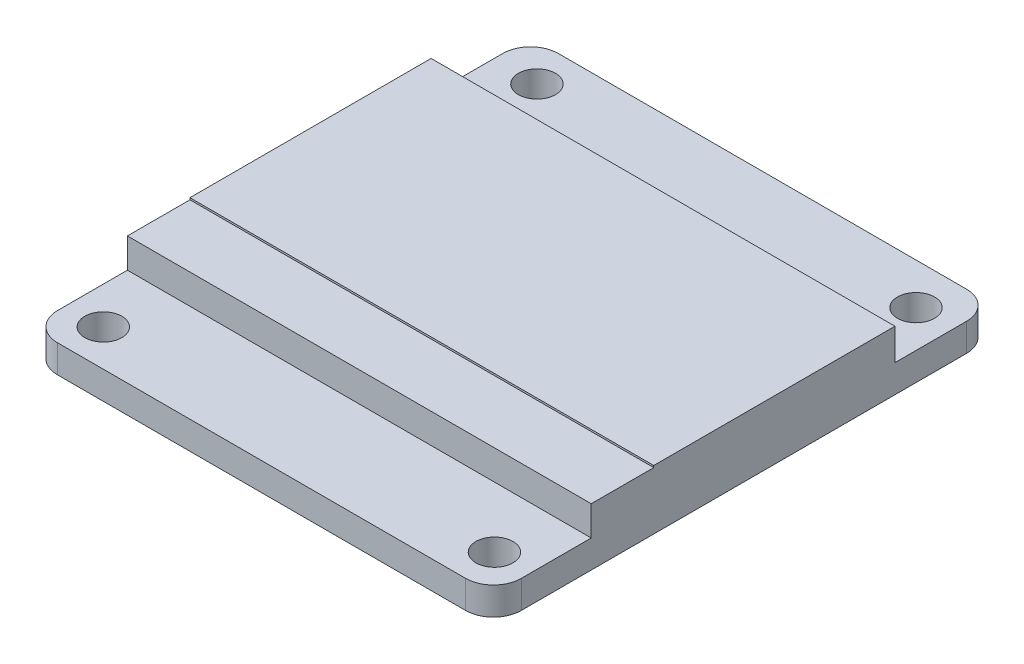
from build123d import *

# Parameters (mm, degrees)
EXTRUDE_1_DEPTH     = 1.5
SKETCH_3_R          = 1
CUT_EXTRUDE_1_DEPTH = 152.226038202
SKETCH_4_W          = 25
SKETCH_4_H          = 16.37
EXTRUDE_2_DEPTH     = 1.6
SKETCH_5_W          = 25
SKETCH_5_H          = 13
EXTRUDE_3_DEPTH     = 0.1


with BuildPart() as part:
    # 草图2 → 凸台-拉伸1 (new body)
    with BuildSketch(Plane(origin=(0, 0, 0), x_dir=(1, 0, 0), z_dir=(0, 1, 0))):
        with BuildLine():
            Line((-118.257462687, 92.332089552), (-96.257462687, 92.332089552))
            ThreePointArc((-96.257462687, 92.332089552), (-95.196802515, 91.892749724), (-94.757462687, 90.832089552))
            Line((-94.757462687, 90.832089552), (-94.757462687, 66.832089552))
            ThreePointArc((-94.757462687, 66.832089552), (-95.196802515, 65.77142938), (-96.257462687, 65.332089552))
            Line((-96.257462687, 65.332089552), (-118.257462687, 65.332089552))
            ThreePointArc((-118.257462687, 65.332089552), (-119.318122858, 65.77142938), (-119.757462687, 66.832089552))
            Line((-119.757462687, 66.832089552), (-119.757462687, 90.832089552))
            ThreePointArc((-119.757462687, 90.832089552), (-119.318122858, 91.892749724), (-118.257462687, 92.332089552))
        make_face()
    extrude(amount=EXTRUDE_1_DEPTH)

    # 草图3 → 切除-拉伸1 (cut, through all)
    with BuildSketch(Plane(origin=(0, 1.5, 0), x_dir=(1, 0, 0), z_dir=(0, 1, 0))):
        with Locations((-117.412980345, 90.332089552)):
            Circle(SKETCH_3_R)
        with Locations((-96.757462687, 90.10796681)):
            Circle(SKETCH_3_R)
        with Locations((-96.704398074, 67.332089552)):
            Circle(SKETCH_3_R)
        with Locations((-117.757462687, 67.303227869)):
            Circle(SKETCH_3_R)
    extrude(amount=-CUT_EXTRUDE_1_DEPTH, mode=Mode.SUBTRACT)

    # 草图4 → 凸台-拉伸2 (add)
    with BuildSketch(Plane(origin=(0, 1.5, 0), x_dir=(1, 0, 0), z_dir=(0, 1, 0))):
        with Locations((-107.257462687, 78.787089552)):
            Rectangle(SKETCH_4_W, SKETCH_4_H)
    extrude(amount=EXTRUDE_2_DEPTH)

    # 草图5 → 凸台-拉伸3 (add)
    with BuildSketch(Plane(origin=(0, 3.1, 0), x_dir=(1, 0, 0), z_dir=(0, 1, 0))):
        with Locations((-107.257462687, 80.472089552)):
            Rectangle(SKETCH_5_W, SKETCH_5_H)
    extrude(amount=EXTRUDE_3_DEPTH)


solid = part.part
